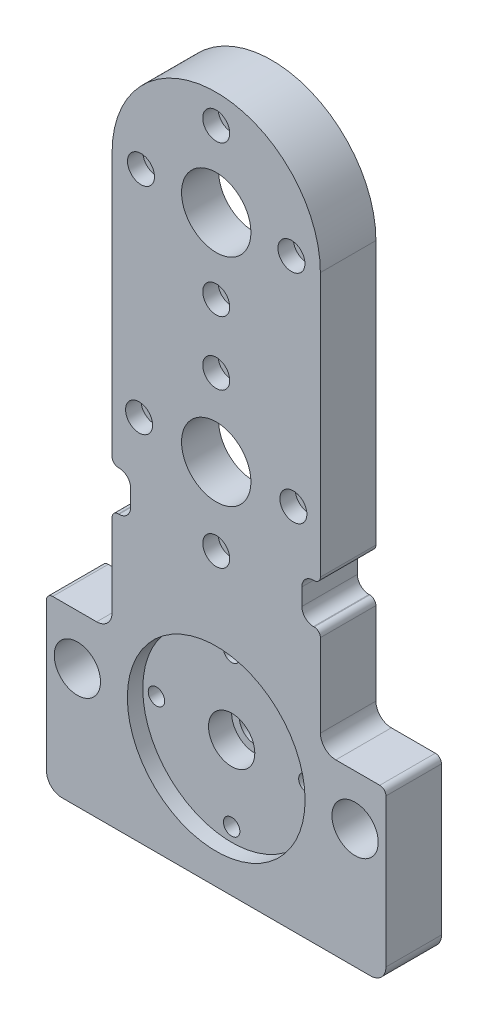
from build123d import *

# Parameters (mm, degrees)
BOLT_CIRCLE_R                                     = 14.2748
BOLT_CIRCLE_R_2                                   = 6.35
BASE_DEPTH                                        = 11.43
STRUCTURE_TUBE_CONNECTION_COUNTERBORE_D           = 6.7564
STRUCTURE_TUBE_CONNECTION_COUNTERBORE_CBORE_D     = 11.1125
STRUCTURE_TUBE_CONNECTION_COUNTERBORE_CBORE_DEPTH = 6.35
STRUCTURE_TUBE_CONNECTION_COUNTERBORE_PA_COUNT    = 4
SPINDLE_CONNECTION_COUNTERBORE_D                  = 6.7564
SPINDLE_CONNECTION_COUNTERBORE_CBORE_D            = 11.1125
SPINDLE_CONNECTION_COUNTERBORE_CBORE_DEPTH        = 6.35
SPINDLE_CONNECTION_COUNTERBORE_PATTERN_COUNT      = 4
SKETCH16_R                                        = 36.576
STRUCTURE_TUBE_MOUNTING_POCKET_DEPTH              = 6.35
SKETCH17_R                                        = 36.576
SPINDLE_MOUNTING_POCKET_DEPTH                     = 7.62
SKETCH18_R                                        = 9.525
LEAD_SCREW_THROUGH_HOLE_DEPTH                     = 9.525
SKETCH20_R                                        = 9.525
RAIL_MOUNTING_PILOT_HOLES_DEPTH                   = 169.338787438
GENERIC_ROUNDING_FILLET_R                         = 6.35
WOOD_SPINDLE_CBORE_D                              = 6.7564
WOOD_SPINDLE_CBORE_CBORE_D                        = 11.1125
WOOD_SPINDLE_CBORE_CBORE_DEPTH                    = 6.35
CIRPATTERN1_COUNT                                 = 4
SKETCH30_R                                        = 36.576
WOOD_SPINDLE_MOUNTING_POCKET_DEPTH                = 7.62
CROSS_SLIDE_FILLETS_R                             = 4.7625
FILLET2_R                                         = 2.54


with BuildPart() as part:
    # Bolt circle → Base (new, symmetric)
    with BuildSketch(Plane.XY):
        with BuildLine():
            Line((-42.8625, 88.9), (-42.8625, -22.1615))
            Line((-42.8625, -22.1615), (-35.2425, -22.1615))
            Line((-35.2425, -22.1615), (-35.2425, -38.6715))
            Line((-35.2425, -38.6715), (-42.8625, -38.6715))
            Line((-42.8625, -38.6715), (-42.8625, -81.5975))
            Line((-42.8625, -81.5975), (-69.85, -81.5975))
            Line((-69.85, -81.5975), (-69.85, -151.4475))
            Line((-69.85, -151.4475), (69.85, -151.4475))
            Line((69.85, -151.4475), (69.85, -81.5975))
            Line((69.85, -81.5975), (42.8625, -81.5975))
            Line((42.8625, -81.5975), (42.8625, -38.6715))
            Line((42.8625, -38.6715), (35.2425, -38.6715))
            Line((35.2425, -38.6715), (35.2425, -22.1615))
            Line((35.2425, -22.1615), (42.8625, -22.1615))
            Line((42.8625, -22.1615), (42.8625, 88.9))
            ThreePointArc((42.8625, 88.9), (0, 131.7625), (-42.8625, 88.9))
        make_face()
        with Locations((0, 88.9)):
            Circle(BOLT_CIRCLE_R, mode=Mode.SUBTRACT)
        Circle(BOLT_CIRCLE_R, mode=Mode.SUBTRACT)
        with Locations((0, -102.235)):
            Circle(BOLT_CIRCLE_R_2, mode=Mode.SUBTRACT)
    extrude(amount=BASE_DEPTH, both=True)

    # Structure tube connection counterbore (through all)
    with Locations(Plane(origin=(0, 0, -11.43), x_dir=(-1, 0, 0), z_dir=(0, 0, -1))):
        with Locations((0, -71.27875)):
            structure_tube_connection_counterbore = CounterBoreHole(STRUCTURE_TUBE_CONNECTION_COUNTERBORE_D / 2, STRUCTURE_TUBE_CONNECTION_COUNTERBORE_CBORE_D / 2, STRUCTURE_TUBE_CONNECTION_COUNTERBORE_CBORE_DEPTH)

    # Structure tube connection counterbore pattern: Structure tube connection counterbore ×4 about axis
    structure_tube_connection_counterbore_pa_axis = Axis((0, -102.235, 11.43), (0, 0, -1))
    for i in range(1, STRUCTURE_TUBE_CONNECTION_COUNTERBORE_PA_COUNT):
        add(structure_tube_connection_counterbore.rotate(structure_tube_connection_counterbore_pa_axis, i * 360 / STRUCTURE_TUBE_CONNECTION_COUNTERBORE_PA_COUNT), mode=Mode.SUBTRACT)

    # Spindle connection counterbore (through all)
    with Locations(Plane.XY.offset(11.43)):
        with Locations((0, 31.75)):
            spindle_connection_counterbore = CounterBoreHole(SPINDLE_CONNECTION_COUNTERBORE_D / 2, SPINDLE_CONNECTION_COUNTERBORE_CBORE_D / 2, SPINDLE_CONNECTION_COUNTERBORE_CBORE_DEPTH)

    # Spindle connection counterbore pattern: Spindle connection counterbore ×4 about axis
    spindle_connection_counterbore_pattern_axis = Axis((0, 0, 11.43), (0, 0, -1))
    for i in range(1, SPINDLE_CONNECTION_COUNTERBORE_PATTERN_COUNT):
        add(spindle_connection_counterbore.rotate(spindle_connection_counterbore_pattern_axis, i * 360 / SPINDLE_CONNECTION_COUNTERBORE_PATTERN_COUNT), mode=Mode.SUBTRACT)

    # Sketch16 → Structure tube mounting pocket (cut)
    with BuildSketch(Plane.XY.offset(11.43)):
        with Locations((0, -102.235)):
            Circle(SKETCH16_R)
    extrude(amount=-STRUCTURE_TUBE_MOUNTING_POCKET_DEPTH, mode=Mode.SUBTRACT)

    # Sketch17 → Spindle mounting pocket (cut)
    with BuildSketch(Plane(origin=(0, 0, -11.43), x_dir=(-1, 0, 0), z_dir=(0, 0, -1))):
        Circle(SKETCH17_R)
    extrude(amount=-SPINDLE_MOUNTING_POCKET_DEPTH, mode=Mode.SUBTRACT)

    # Sketch18 → Lead screw through hole (cut)
    with BuildSketch(Plane.XY.offset(5.08)):
        with Locations((0, -102.235)):
            Circle(SKETCH18_R)
    extrude(amount=-LEAD_SCREW_THROUGH_HOLE_DEPTH, mode=Mode.SUBTRACT)

    # Sketch20 → Rail mounting pilot_holes (cut, through all)
    with BuildSketch(Plane.XY.offset(11.43)):
        with Locations((57.15, -102.235)):
            Circle(SKETCH20_R)
        with Locations((-57.15, -102.235)):
            Circle(SKETCH20_R)
    extrude(amount=-RAIL_MOUNTING_PILOT_HOLES_DEPTH, mode=Mode.SUBTRACT)

    # Generic_rounding_fillet
    generic_rounding_fillet_edges = [part.edges().sort_by_distance(p)[0] for p in [
        (-69.85, -151.4475, 0),
        (69.85, -151.4475, 0),
        (-42.8625, -81.5975, 0),
        (42.8625, -81.5975, 0),
    ]]
    fillet(generic_rounding_fillet_edges, radius=GENERIC_ROUNDING_FILLET_R)

    # wood_spindle_CBORE (through all)
    with Locations(Plane.XY.offset(11.43)):
        with Locations((0, 119.85625)):
            wood_spindle_cbore = CounterBoreHole(WOOD_SPINDLE_CBORE_D / 2, WOOD_SPINDLE_CBORE_CBORE_D / 2, WOOD_SPINDLE_CBORE_CBORE_DEPTH)

    # CirPattern1: wood_spindle_CBORE ×4 about axis
    cirpattern1_axis = Axis((0, 88.9, 11.43), (0, 0, -1))
    for i in range(1, CIRPATTERN1_COUNT):
        add(wood_spindle_cbore.rotate(cirpattern1_axis, i * 360 / CIRPATTERN1_COUNT), mode=Mode.SUBTRACT)

    # Sketch30 → wood_spindle_mounting_pocket (cut)
    with BuildSketch(Plane(origin=(0, 0, -11.43), x_dir=(-1, 0, 0), z_dir=(0, 0, -1))):
        with Locations((0, 88.9)):
            Circle(SKETCH30_R)
    extrude(amount=-WOOD_SPINDLE_MOUNTING_POCKET_DEPTH, mode=Mode.SUBTRACT)

    # cross_slide_fillets
    cross_slide_fillets_edges = [part.edges().sort_by_distance(p)[0] for p in [
        (-35.2425, -38.6715, 0),
        (-35.2425, -22.1615, 0),
        (35.2425, -38.6715, 0),
        (35.2425, -22.1615, 0),
    ]]
    fillet(cross_slide_fillets_edges, radius=CROSS_SLIDE_FILLETS_R)

    # Fillet2
    fillet2_edges = [part.edges().sort_by_distance(p)[0] for p in [
        (-42.8625, -22.1615, 0),
        (42.8625, -22.1615, 0),
        (42.8625, -38.6715, 0),
        (-42.8625, -38.6715, 0),
        (69.85, -81.5975, 0),
        (-69.85, -81.5975, 0),
    ]]
    fillet(fillet2_edges, radius=FILLET2_R)


solid = part.part
